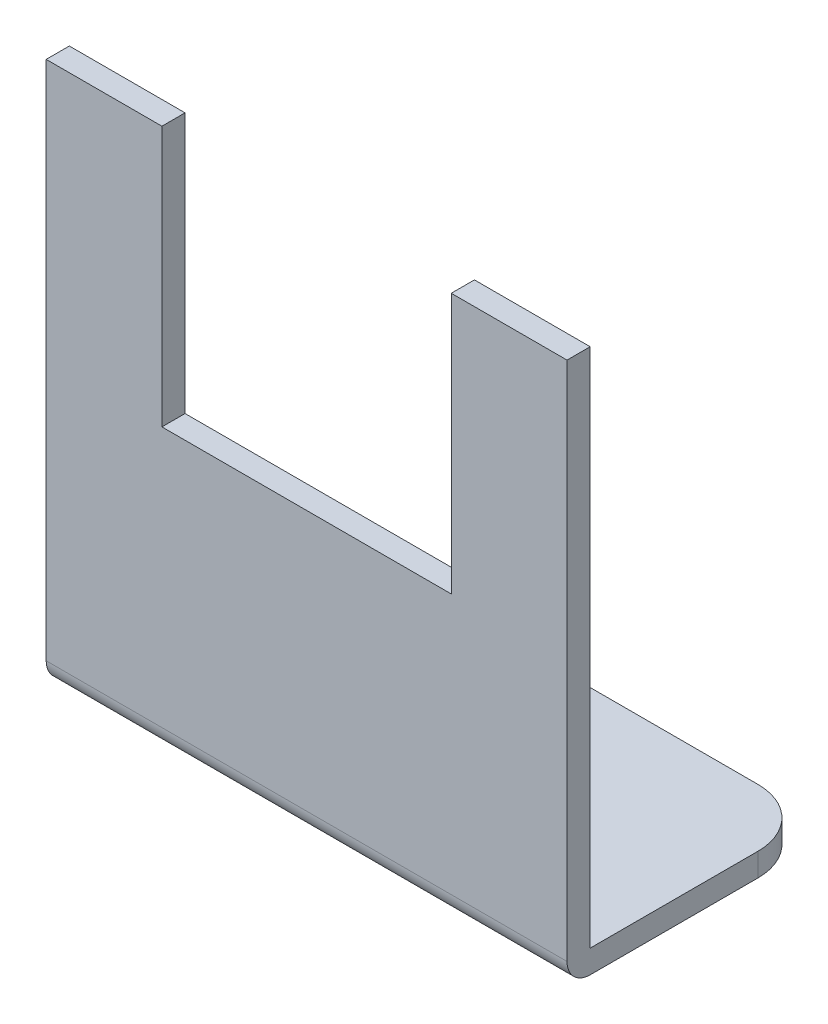
from build123d import *

# Parameters (mm, degrees)
SKETCH1_W           = 45
SKETCH1_H           = 47
BOSS_EXTRUDE1_DEPTH = 2
SKETCH2_W           = 45
SKETCH2_H           = 2
BOSS_EXTRUDE2_DEPTH = 19.5
FILLET1_R           = 2
FILLET2_R           = 5
SKETCH3_W           = 25
SKETCH3_H           = 22.5
CUT_EXTRUDE1_DEPTH  = 39.99679474
SKETCH4_R           = 1.5
CUT_EXTRUDE2_DEPTH  = 54.958317246


with BuildPart() as part:
    # Sketch1 → Boss-Extrude1 (new body)
    with BuildSketch(Plane.XY):
        Rectangle(SKETCH1_W, SKETCH1_H)
    extrude(amount=BOSS_EXTRUDE1_DEPTH)

    # Sketch2 → Boss-Extrude2 (add)
    with BuildSketch(Plane(origin=(0, 0, 0), x_dir=(-1, 0, 0), z_dir=(0, 0, -1))):
        with Locations((0, -22.5)):
            Rectangle(SKETCH2_W, SKETCH2_H)
    extrude(amount=BOSS_EXTRUDE2_DEPTH)

    # Fillet1
    fillet1_edges = [part.edges().sort_by_distance(p)[0] for p in [
        (0, -23.5, 2),
    ]]
    fillet(fillet1_edges, radius=FILLET1_R)

    # Fillet2
    fillet2_edges = [part.edges().sort_by_distance(p)[0] for p in [
        (-22.5, -22.5, -19.5),
        (22.5, -22.5, -19.5),
    ]]
    fillet(fillet2_edges, radius=FILLET2_R)

    # Sketch3 → Cut-Extrude1 (cut, through all)
    with BuildSketch(Plane.XY.offset(2)):
        with Locations((0, 12.25)):
            Rectangle(SKETCH3_W, SKETCH3_H)
    extrude(amount=-CUT_EXTRUDE1_DEPTH, mode=Mode.SUBTRACT)

    # Sketch4 → Cut-Extrude2 (cut, through all)
    with BuildSketch(Plane(origin=(0, -21.5, 0), x_dir=(1, 0, 0), z_dir=(0, 1, 0))):
        with Locations((0, 14.5)):
            Circle(SKETCH4_R)
    extrude(amount=-CUT_EXTRUDE2_DEPTH, mode=Mode.SUBTRACT)


solid = part.part
